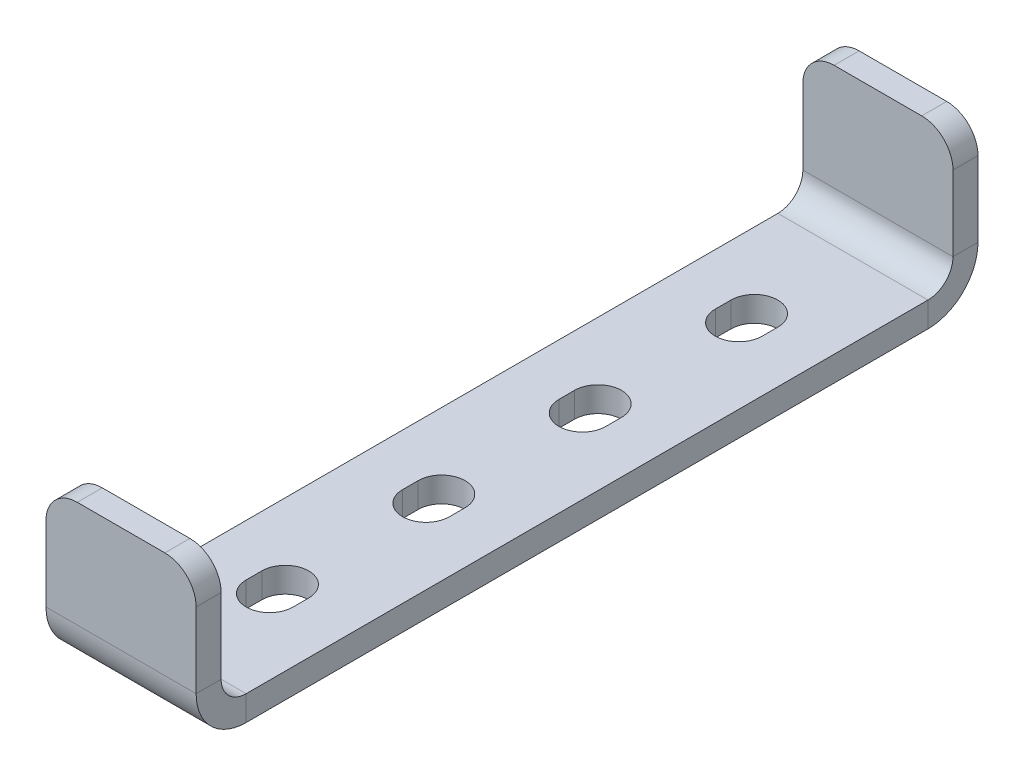
from build123d import *

# Parameters (mm, degrees)
SM_BASE_FLANGE_1_DEPTH = 24
CUT_EXTRUDE_1_DEPTH    = 135.033577883
FILLET_1_R             = 10


# Sheet-metal steps are written as plain solids
with BuildPart() as part:
    # Sketch 1 → 基体-法兰1 (new, symmetric)
    with BuildSketch(Plane(origin=(0, 0, 0), x_dir=(0, 0, -1), z_dir=(1, 0, 0))):
        with BuildLine():
            Line((-125, 50), (-125, 16))
            ThreePointArc((-125, 16), (-120.313708499, 4.686291501), (-109, 0))
            Line((-109, 0), (109, 0))
            ThreePointArc((109, 0), (120.313708499, 4.686291501), (125, 16))
            Line((125, 16), (125, 50))
            Line((125, 50), (117, 50))
            Line((117, 50), (117, 16))
            ThreePointArc((117, 16), (114.656854249, 10.343145751), (109, 8))
            Line((109, 8), (-109, 8))
            ThreePointArc((-109, 8), (-114.656854249, 10.343145751), (-117, 16))
            Line((-117, 16), (-117, 50))
            Line((-117, 50), (-125, 50))
        make_face()
    extrude(amount=SM_BASE_FLANGE_1_DEPTH, both=True)

    # 草图6 → 切除-拉伸1 (cut, through all)
    with BuildSketch(Plane(origin=(0, 8, 0), x_dir=(1, 0, 0), z_dir=(0, 1, 0))):
        with BuildLine():
            Line((7.5, 77.5), (7.5, 72.5))
            ThreePointArc((7.5, 72.5), (0, 65), (-7.5, 72.5))
            Line((-7.5, 72.5), (-7.5, 77.5))
            ThreePointArc((-7.5, 77.5), (0, 85), (7.5, 77.5))
        make_face()
        with BuildLine():
            Line((7.5, 27.5), (7.5, 22.5))
            ThreePointArc((7.5, 22.5), (0, 15), (-7.5, 22.5))
            Line((-7.5, 22.5), (-7.5, 27.5))
            ThreePointArc((-7.5, 27.5), (0, 35), (7.5, 27.5))
        make_face()
        with BuildLine():
            Line((7.5, -22.5), (7.5, -27.5))
            ThreePointArc((7.5, -27.5), (0, -35), (-7.5, -27.5))
            Line((-7.5, -27.5), (-7.5, -22.5))
            ThreePointArc((-7.5, -22.5), (0, -15), (7.5, -22.5))
        make_face()
        with BuildLine():
            Line((7.5, -72.5), (7.5, -77.5))
            ThreePointArc((7.5, -77.5), (0, -85), (-7.5, -77.5))
            Line((-7.5, -77.5), (-7.5, -72.5))
            ThreePointArc((-7.5, -72.5), (0, -65), (7.5, -72.5))
        make_face()
    extrude(amount=-CUT_EXTRUDE_1_DEPTH, mode=Mode.SUBTRACT)

    # 圆角1
    fillet_1_edges = [part.edges().sort_by_distance(p)[0] for p in [
        (-24, 50, 121),
        (-24, 50, -121),
        (24, 50, 121),
        (24, 50, -121),
    ]]
    fillet(fillet_1_edges, radius=FILLET_1_R)


solid = part.part
